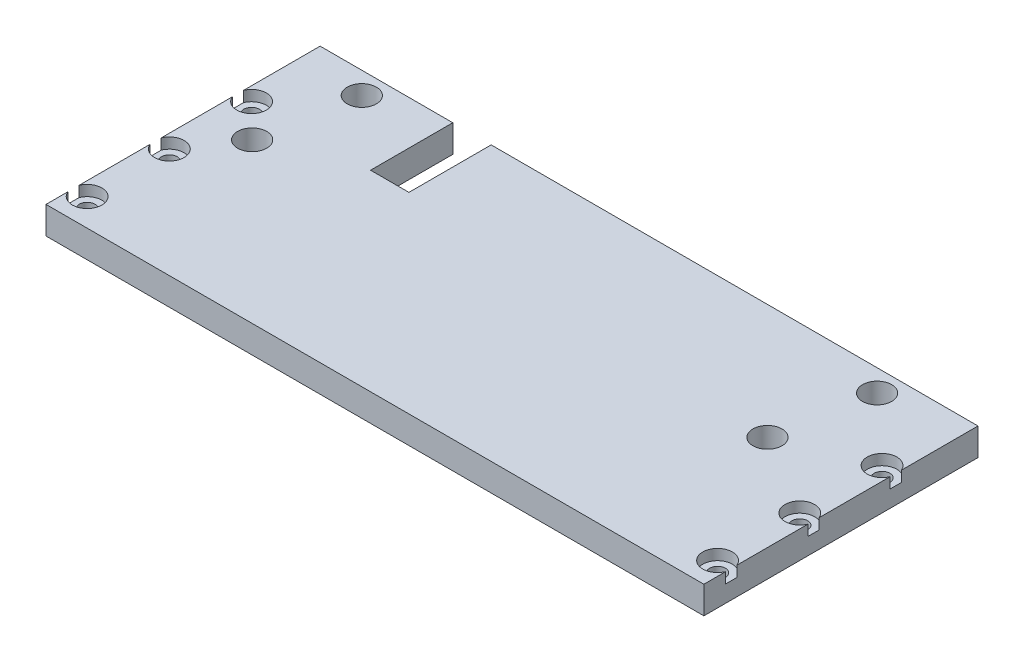
from build123d import *

# Parameters (mm, degrees)
SKETCH1_W           = 152.4
SKETCH1_H           = 63.5
BOSS_EXTRUDE1_DEPTH = 6.35
SKETCH5_W           = 8.89
SKETCH5_H           = 19.05
CUT_EXTRUDE2_DEPTH  = 166.222070257
SKETCH16_R          = 3.3782
CUT_EXTRUDE3_DEPTH  = 166.222070257
SKETCH6_R           = 3.3782
CUT_EXTRUDE4_DEPTH  = 166.222070257
SKETCH13_R          = 3.3782
CUT_EXTRUDE5_DEPTH  = 166.222070257
SKETCH25_R          = 3.429
CUT_EXTRUDE6_DEPTH  = 2.4638
SKETCH2_R           = 1.8288
CUT_EXTRUDE7_DEPTH  = 6.35


with BuildPart() as part:
    # Sketch1 → Boss-Extrude1 (new body)
    with BuildSketch(Plane(origin=(0, 0, 0), x_dir=(1, 0, 0), z_dir=(0, 1, 0))):
        with Locations((-76.2, 31.75)):
            Rectangle(SKETCH1_W, SKETCH1_H)
    extrude(amount=BOSS_EXTRUDE1_DEPTH)

    # Sketch5 → Cut-Extrude2 (cut, through all)
    with BuildSketch(Plane(origin=(0, 6.35, 0), x_dir=(1, 0, 0), z_dir=(0, 1, 0))):
        with Locations((-117.221, 53.975)):
            Rectangle(SKETCH5_W, SKETCH5_H)
    extrude(amount=-CUT_EXTRUDE2_DEPTH, mode=Mode.SUBTRACT)

    # Sketch16 → Cut-Extrude3 (cut, through all)
    with BuildSketch(Plane(origin=(0, 6.35, 0), x_dir=(1, 0, 0), z_dir=(0, 1, 0))):
        with Locations((-141.478, 36.83)):
            Circle(SKETCH16_R)
    extrude(amount=-CUT_EXTRUDE3_DEPTH, mode=Mode.SUBTRACT)

    # Sketch6 → Cut-Extrude4 (cut, through all)
    with BuildSketch(Plane(origin=(0, 6.35, 0), x_dir=(1, 0, 0), z_dir=(0, 1, 0))):
        with Locations((-137.668, 58.42)):
            Circle(SKETCH6_R)
    extrude(amount=-CUT_EXTRUDE4_DEPTH, mode=Mode.SUBTRACT)

    # Sketch13 → Cut-Extrude5 (cut, through all)
    with BuildSketch(Plane(origin=(0, 6.35, 0), x_dir=(1, 0, 0), z_dir=(0, 1, 0))):
        with Locations((-22.098, 36.83)):
            Circle(SKETCH13_R)
        with Locations((-18.288, 58.42)):
            Circle(SKETCH13_R)
    extrude(amount=-CUT_EXTRUDE5_DEPTH, mode=Mode.SUBTRACT)

    # Sketch25 → Cut-Extrude6 (cut)
    with BuildSketch(Plane(origin=(0, 6.35, 0), x_dir=(1, 0, 0), z_dir=(0, 1, 0))):
        with Locations((-149.225, 44.45)):
            Circle(SKETCH25_R)
        with Locations((-149.225, 25.4)):
            Circle(SKETCH25_R)
        with Locations((-149.225, 6.35)):
            Circle(SKETCH25_R)
        with Locations((-3.175, 44.45)):
            Circle(SKETCH25_R)
        with Locations((-3.175, 25.4)):
            Circle(SKETCH25_R)
        with Locations((-3.175, 6.35)):
            Circle(SKETCH25_R)
    extrude(amount=-CUT_EXTRUDE6_DEPTH, mode=Mode.SUBTRACT)

    # Sketch2 → Cut-Extrude7 (cut)
    with BuildSketch(Plane(origin=(0, 6.35, 0), x_dir=(1, 0, 0), z_dir=(0, 1, 0))):
        with Locations((-149.225, 44.45)):
            Circle(SKETCH2_R)
        with Locations((-149.225, 25.4)):
            Circle(SKETCH2_R)
        with Locations((-149.225, 6.35)):
            Circle(SKETCH2_R)
        with Locations((-3.175, 25.4)):
            Circle(SKETCH2_R)
        with Locations((-3.175, 44.45)):
            Circle(SKETCH2_R)
        with Locations((-3.175, 6.35)):
            Circle(SKETCH2_R)
    extrude(amount=-CUT_EXTRUDE7_DEPTH, mode=Mode.SUBTRACT)


solid = part.part
